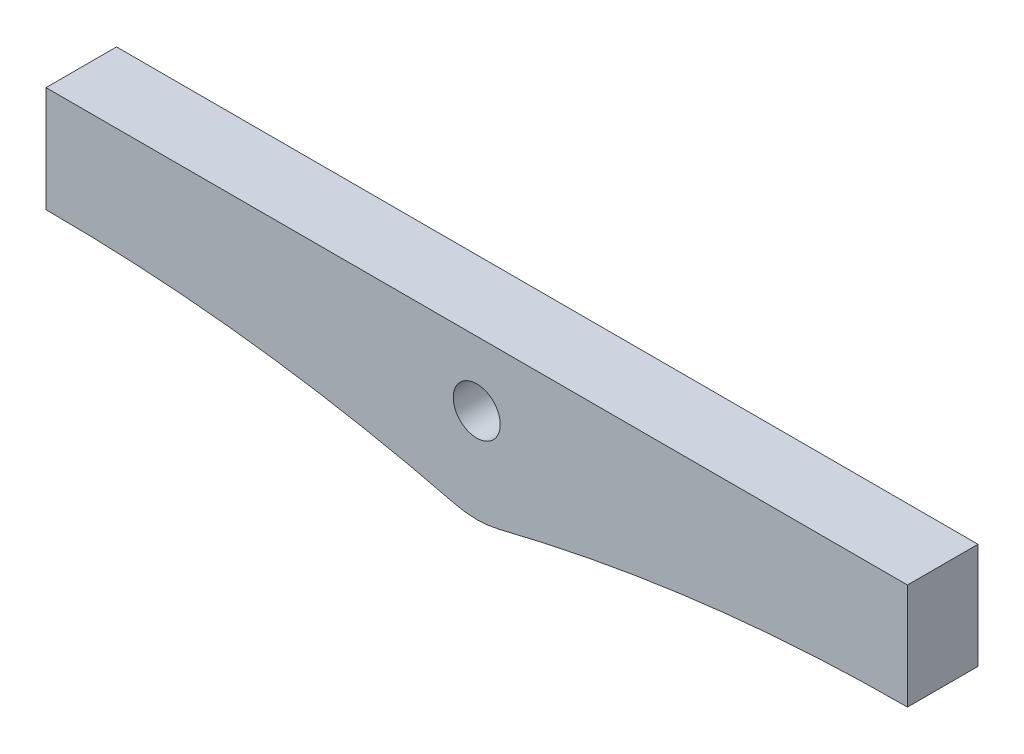
from build123d import *

# Parameters (mm, degrees)
SKETCH1_R           = 2
BOSS_EXTRUDE1_DEPTH = 6


with BuildPart() as part:
    # Sketch1 → Boss-Extrude1 (new body)
    with BuildSketch(Plane.XY):
        with BuildLine():
            Line((-36.65, 5.5), (-36.65, -3.5))
            ThreePointArc((-36.65, -3.5), (-19.162328937, -4.569579006), (-1.935352565, -7.762371445))
            ThreePointArc((-1.935352565, -7.762371445), (0, -8), (1.935352565, -7.762371445))
            ThreePointArc((1.935352565, -7.762371445), (19.162328937, -4.569579006), (36.65, -3.5))
            Line((36.65, -3.5), (36.65, 5.5))
            Line((36.65, 5.5), (-36.65, 5.5))
        make_face()
        Circle(SKETCH1_R, mode=Mode.SUBTRACT)
    extrude(amount=BOSS_EXTRUDE1_DEPTH)


solid = part.part
